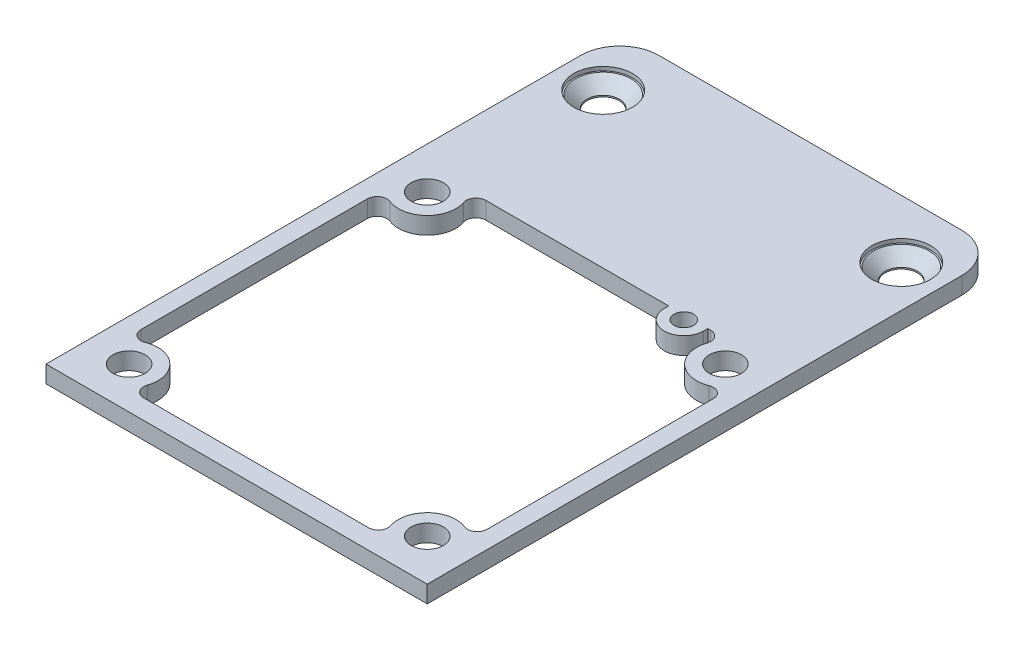
from build123d import *

# Parameters (mm, degrees)
SKETCH1_R               = 1.65
SKETCH1_R_2             = 1
BASE_SHAPE_DEPTH        = 1.75
MILLING_FILLETS_R       = 1
SKETCH3_R               = 3
SCREW_HEAD_CUT_DEPTH    = 0.4
SCREW_HEAD_CHAMFER_SIZE = 1.2


with BuildPart() as part:
    # Sketch1 → Base shape (new body)
    with BuildSketch(Plane(origin=(0, 0, 0), x_dir=(1, 0, 0), z_dir=(0, 1, 0))):
        with BuildLine():
            Line((15.5, 39.2), (-15.5, 39.2))
            ThreePointArc((-15.5, 39.2), (-18.328427125, 38.028427125), (-19.5, 35.2))
            Line((-19.5, 35.2), (-19.5, -19.5))
            Line((-19.5, -19.5), (19.5, -19.5))
            Line((19.5, -19.5), (19.5, 35.2))
            ThreePointArc((19.5, 35.2), (18.328427125, 38.028427125), (15.5, 39.2))
        make_face()
        with BuildLine():
            Line((17.7, 13.606832327), (17.7, -13.606832327))
            ThreePointArc((17.7, -13.606832327), (13.284874461, -13.049822367), (13.341630288, -17.499583304))
            Line((13.341630288, -17.499583304), (-13.341630288, -17.499583304))
            ThreePointArc((-13.341630288, -17.499583304), (-13.284874461, -13.049822367), (-17.7, -13.606832327))
            Line((-17.7, -13.606832327), (-17.7, 13.606832327))
            ThreePointArc((-17.7, 13.606832327), (-13.284874461, 13.049822367), (-13.341630288, 17.499583304))
            Line((-13.341630288, 17.499583304), (7.2, 17.499583304))
            Line((7.2, 17.499583304), (7.2, 17.05))
            ThreePointArc((7.2, 17.05), (9.2, 15.05), (11.2, 17.05))
            Line((11.2, 17.05), (11.2, 17.499583304))
            Line((11.2, 17.499583304), (13.341630288, 17.499583304))
            ThreePointArc((13.341630288, 17.499583304), (13.284874461, 13.049822367), (17.7, 13.606832327))
        make_face(mode=Mode.SUBTRACT)
        with Locations((-15.25, 33.25)):
            Circle(SKETCH1_R, mode=Mode.SUBTRACT)
        with Locations((15.25, 33.25)):
            Circle(SKETCH1_R, mode=Mode.SUBTRACT)
        with Locations((9.2, 17.05)):
            Circle(SKETCH1_R_2, mode=Mode.SUBTRACT)
        with Locations((15.25, -15.25)):
            Circle(SKETCH1_R, mode=Mode.SUBTRACT)
        with Locations((15.25, 15.25)):
            Circle(SKETCH1_R, mode=Mode.SUBTRACT)
        with Locations((-15.25, 15.25)):
            Circle(SKETCH1_R, mode=Mode.SUBTRACT)
        with Locations((-15.25, -15.25)):
            Circle(SKETCH1_R, mode=Mode.SUBTRACT)
    extrude(amount=BASE_SHAPE_DEPTH)

    # Milling fillets
    milling_fillets_edges = [part.edges().sort_by_distance(p)[0] for p in [
        (-17.7, 0.875, 13.606832327),
        (-13.341630288, 0.875, 17.499583304),
        (13.341630288, 0.875, 17.499583304),
        (17.7, 0.875, 13.606832327),
        (17.7, 0.875, -13.606832327),
        (13.341630288, 0.875, -17.499583304),
        (-13.341630288, 0.875, -17.499583304),
        (-17.7, 0.875, -13.606832327),
    ]]
    fillet(milling_fillets_edges, radius=MILLING_FILLETS_R)

    # Sketch3 → Screw head cut (cut)
    with BuildSketch(Plane(origin=(0, 1.75, 0), x_dir=(1, 0, 0), z_dir=(0, 1, 0))):
        with Locations((-15.25, 33.25)):
            Circle(SKETCH3_R)
        with Locations((15.25, 33.25)):
            Circle(SKETCH3_R)
    extrude(amount=-SCREW_HEAD_CUT_DEPTH, mode=Mode.SUBTRACT)

    # Screw head chamfer
    screw_head_chamfer_edges = [part.edges().sort_by_distance(p)[0] for p in [
        (13.6, 1.35, -33.25),
        (-16.9, 1.35, -33.25),
    ]]
    chamfer(screw_head_chamfer_edges, length=SCREW_HEAD_CHAMFER_SIZE)


solid = part.part
